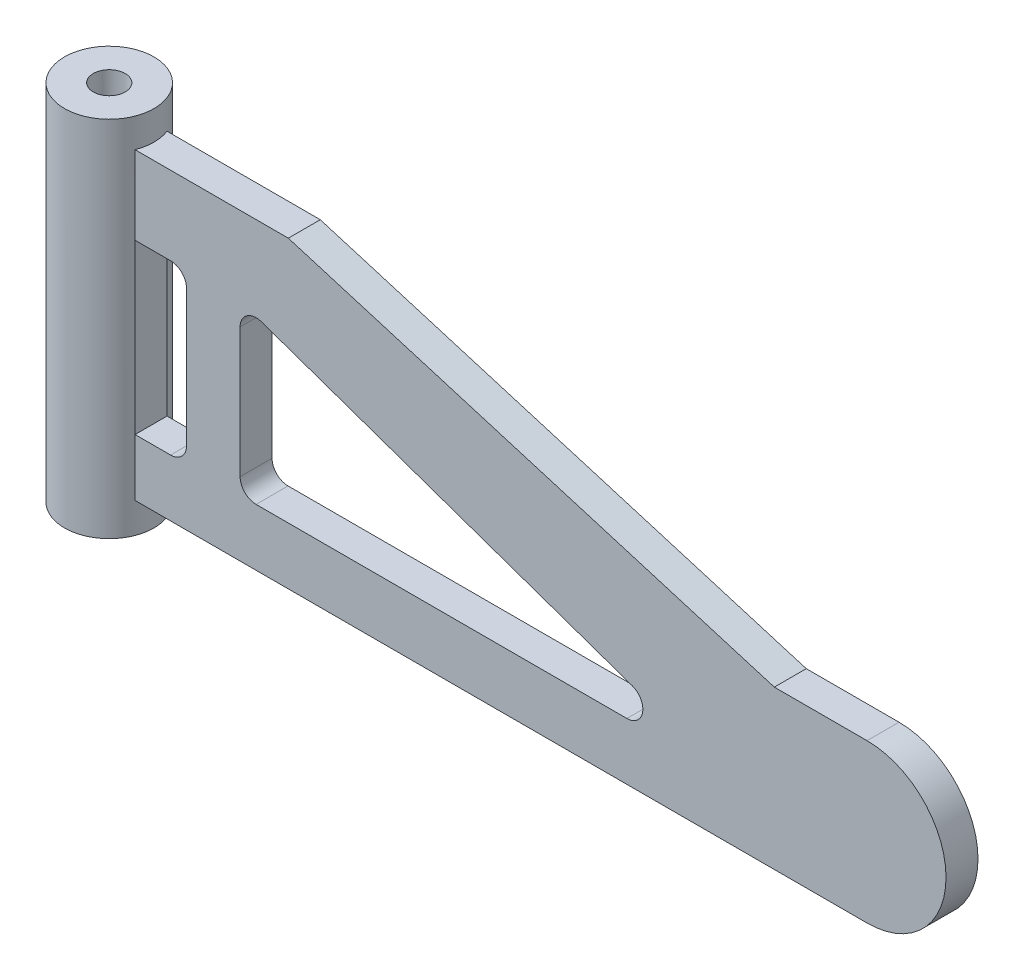
from build123d import *

# Parameters (mm, degrees)
EXTRUDE_1_DEPTH          = 10
SKETCH_2_R               = 14
EXTRUDE_2_DEPTH          = 95
EXTRUDE_START            = 9.1
SKETCH_3_R               = 14
EXTRUDE_3_DEPTH          = 9.1
SKETCH_5_R               = 14
EXTRUDE_4_DEPTH          = 9.5
CUT_EXTRUDE_1_DEPTH      = 211.390033392
CUT_EXTRUDE_1_DEPTH_BACK = 211.390033392
SKETCH_6_R               = 5
CUT_EXTRUDE_2_DEPTH      = 19.5


with BuildPart() as part:
    # 스케치1 → 보스-돌출1 (new body)
    with BuildSketch(Plane.XY):
        with BuildLine():
            Line((-104.637493626, 39.858490566), (-104.637493626, -55.141509434))
            Line((-104.637493626, -55.141509434), (151.362506374, -55.141509434))
            ThreePointArc((151.362506374, -55.141509434), (176.062506374, -30.441509434), (151.362506374, -5.741509434))
            Line((151.362506374, -5.741509434), (122.362506374, -5.741509434))
            Line((122.362506374, -5.741509434), (-29.637493626, 39.858490566))
            Line((-29.637493626, 39.858490566), (-104.637493626, 39.858490566))
        make_face()
    extrude(amount=EXTRUDE_1_DEPTH)

    # 스케치2 → 보스-돌출2 (add)
    with BuildSketch(Plane(origin=(0, 39.858490566, 0), x_dir=(1, 0, 0), z_dir=(0, 1, 0))):
        with Locations((-90.637493626, -5)):
            Circle(SKETCH_2_R)
    extrude(amount=-EXTRUDE_2_DEPTH)

    # 스케치3 → 보스-돌출3 (add)
    with BuildSketch(Plane(origin=(0, 39.858490566, 0), x_dir=(1, 0, 0), z_dir=(0, 1, 0)).offset(EXTRUDE_START)):
        with Locations((-90.637493626, -5)):
            Circle(SKETCH_3_R)
    extrude(amount=-EXTRUDE_3_DEPTH)

    # 스케치5 → 보스-돌출4 (add)
    with BuildSketch(Plane.XZ.offset(55.141509434)):
        with Locations((-90.637493626, 5)):
            Circle(SKETCH_5_R)
    extrude(amount=EXTRUDE_4_DEPTH)

    # 스케치6 → 컷-돌출1 (cut, two sides: drawn at the far end of the back side and taken through both)
    with BuildSketch(Plane(origin=(0, 48.958490566, 0), x_dir=(1, 0, 0), z_dir=(0, 1, 0)).offset(-CUT_EXTRUDE_1_DEPTH_BACK)):
        with Locations((-90.637493626, -5)):
            Circle(SKETCH_6_R)
    extrude(amount=CUT_EXTRUDE_1_DEPTH + CUT_EXTRUDE_1_DEPTH_BACK, mode=Mode.SUBTRACT)

    # 스케치7 → 컷-돌출2 (cut)
    with BuildSketch(Plane.XY.offset(10)):
        with BuildLine():
            Line((-77.560796795, 15.329522676), (-66.456337958, 15.329522676))
            ThreePointArc((-66.456337958, 15.329522676), (-62.920804052, 13.865056582), (-61.456337958, 10.329522676))
            Line((-61.456337958, 10.329522676), (-61.456337958, -32.291143793))
            ThreePointArc((-61.456337958, -32.291143793), (-62.920804052, -35.826677699), (-66.456337958, -37.291143793))
            Line((-66.456337958, -37.291143793), (-77.560796795, -37.291143793))
            Line((-77.560796795, -37.291143793), (-77.560796795, 15.329522676))
        make_face()
        with BuildLine():
            Line((-44.713398627, 8.282778838), (-44.713398627, -32.291143793))
            ThreePointArc((-44.713398627, -32.291143793), (-43.248932532, -35.826677699), (-39.713398627, -37.291143793))
            Line((-39.713398627, -37.291143793), (76.245027984, -37.291143793))
            ThreePointArc((76.245027984, -37.291143793), (81.1743885, -33.128642988), (77.896362169, -27.571705753))
            Line((77.896362169, -27.571705753), (-38.062064442, 13.002216878))
            ThreePointArc((-38.062064442, 13.002216878), (-42.606781515, 12.360564446), (-44.713398627, 8.282778838))
        make_face()
    extrude(amount=-CUT_EXTRUDE_2_DEPTH, mode=Mode.SUBTRACT)


solid = part.part
